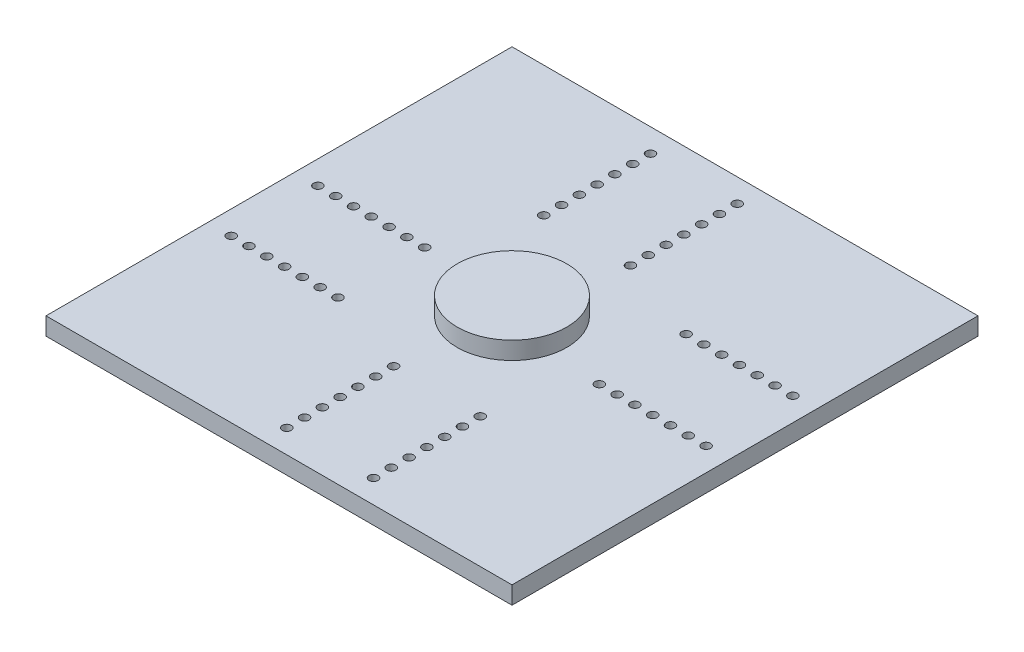
from build123d import *

# Parameters (mm, degrees)
SKETCH1_W           = 167.64
SKETCH1_H           = 167.64
BOSS_EXTRUDE1_DEPTH = 6.35
SKETCH2_R           = 19.725818268
BOSS_EXTRUDE2_DEPTH = 6.35
SKETCH3_R           = 1.6
CUT_EXTRUDE1_DEPTH  = 10


with BuildPart() as part:
    # Sketch1 → Boss-Extrude1 (new body)
    with BuildSketch(Plane(origin=(0, 0, 0), x_dir=(1, 0, 0), z_dir=(0, 1, 0))):
        Rectangle(SKETCH1_W, SKETCH1_H)
    extrude(amount=BOSS_EXTRUDE1_DEPTH)

    # Sketch2 → Boss-Extrude2 (add)
    with BuildSketch(Plane(origin=(0, 6.35, 0), x_dir=(1, 0, 0), z_dir=(0, 1, 0))):
        Circle(SKETCH2_R)
    extrude(amount=BOSS_EXTRUDE2_DEPTH)

    # Sketch3 → Cut-Extrude1 (cut)
    with BuildSketch(Plane(origin=(0, 6.35, 0), x_dir=(1, 0, 0), z_dir=(0, 1, 0))):
        with Locations((5.59999998, 75.42)):
            Circle(SKETCH3_R)
        with Locations((-25.60000002, 75.42)):
            Circle(SKETCH3_R)
        with Locations((5.59999998, 69.02)):
            Circle(SKETCH3_R)
        with Locations((-25.60000002, 69.02)):
            Circle(SKETCH3_R)
        with Locations((5.59999998, 62.62)):
            Circle(SKETCH3_R)
        with Locations((-25.60000002, 62.62)):
            Circle(SKETCH3_R)
        with Locations((5.59999998, 56.22)):
            Circle(SKETCH3_R)
        with Locations((-25.60000002, 56.22)):
            Circle(SKETCH3_R)
        with Locations((5.59999998, 49.82)):
            Circle(SKETCH3_R)
        with Locations((-25.60000002, 49.82)):
            Circle(SKETCH3_R)
        with Locations((5.59999998, 43.42)):
            Circle(SKETCH3_R)
        with Locations((-25.60000002, 43.42)):
            Circle(SKETCH3_R)
        with Locations((5.59999998, 37.02)):
            Circle(SKETCH3_R)
        with Locations((-25.60000002, 37.02)):
            Circle(SKETCH3_R)
        with Locations((75.42, -5.59999998)):
            Circle(SKETCH3_R)
        with Locations((75.42, 25.60000002)):
            Circle(SKETCH3_R)
        with Locations((69.02, -5.59999998)):
            Circle(SKETCH3_R)
        with Locations((62.62, -5.59999998)):
            Circle(SKETCH3_R)
        with Locations((56.22, -5.59999998)):
            Circle(SKETCH3_R)
        with Locations((49.82, -5.59999998)):
            Circle(SKETCH3_R)
        with Locations((43.42, -5.59999998)):
            Circle(SKETCH3_R)
        with Locations((37.02, -5.59999998)):
            Circle(SKETCH3_R)
        with Locations((69.02, 25.60000002)):
            Circle(SKETCH3_R)
        with Locations((62.62, 25.60000002)):
            Circle(SKETCH3_R)
        with Locations((56.22, 25.60000002)):
            Circle(SKETCH3_R)
        with Locations((49.82, 25.60000002)):
            Circle(SKETCH3_R)
        with Locations((43.42, 25.60000002)):
            Circle(SKETCH3_R)
        with Locations((37.02, 25.60000002)):
            Circle(SKETCH3_R)
        with Locations((-5.59999998, -75.42)):
            Circle(SKETCH3_R)
        with Locations((25.60000002, -75.42)):
            Circle(SKETCH3_R)
        with Locations((-5.59999998, -69.02)):
            Circle(SKETCH3_R)
        with Locations((-5.59999998, -62.62)):
            Circle(SKETCH3_R)
        with Locations((-5.59999998, -56.22)):
            Circle(SKETCH3_R)
        with Locations((-5.59999998, -49.82)):
            Circle(SKETCH3_R)
        with Locations((-5.59999998, -43.42)):
            Circle(SKETCH3_R)
        with Locations((-5.59999998, -37.02)):
            Circle(SKETCH3_R)
        with Locations((25.60000002, -69.02)):
            Circle(SKETCH3_R)
        with Locations((25.60000002, -62.62)):
            Circle(SKETCH3_R)
        with Locations((25.60000002, -56.22)):
            Circle(SKETCH3_R)
        with Locations((25.60000002, -49.82)):
            Circle(SKETCH3_R)
        with Locations((25.60000002, -43.42)):
            Circle(SKETCH3_R)
        with Locations((25.60000002, -37.02)):
            Circle(SKETCH3_R)
        with Locations((-75.42, 5.59999998)):
            Circle(SKETCH3_R)
        with Locations((-75.42, -25.60000002)):
            Circle(SKETCH3_R)
        with Locations((-69.02, 5.59999998)):
            Circle(SKETCH3_R)
        with Locations((-62.62, 5.59999998)):
            Circle(SKETCH3_R)
        with Locations((-56.22, 5.59999998)):
            Circle(SKETCH3_R)
        with Locations((-49.82, 5.59999998)):
            Circle(SKETCH3_R)
        with Locations((-43.42, 5.59999998)):
            Circle(SKETCH3_R)
        with Locations((-37.02, 5.59999998)):
            Circle(SKETCH3_R)
        with Locations((-69.02, -25.60000002)):
            Circle(SKETCH3_R)
        with Locations((-62.62, -25.60000002)):
            Circle(SKETCH3_R)
        with Locations((-56.22, -25.60000002)):
            Circle(SKETCH3_R)
        with Locations((-49.82, -25.60000002)):
            Circle(SKETCH3_R)
        with Locations((-43.42, -25.60000002)):
            Circle(SKETCH3_R)
        with Locations((-37.02, -25.60000002)):
            Circle(SKETCH3_R)
    extrude(amount=-CUT_EXTRUDE1_DEPTH, mode=Mode.SUBTRACT)


solid = part.part
